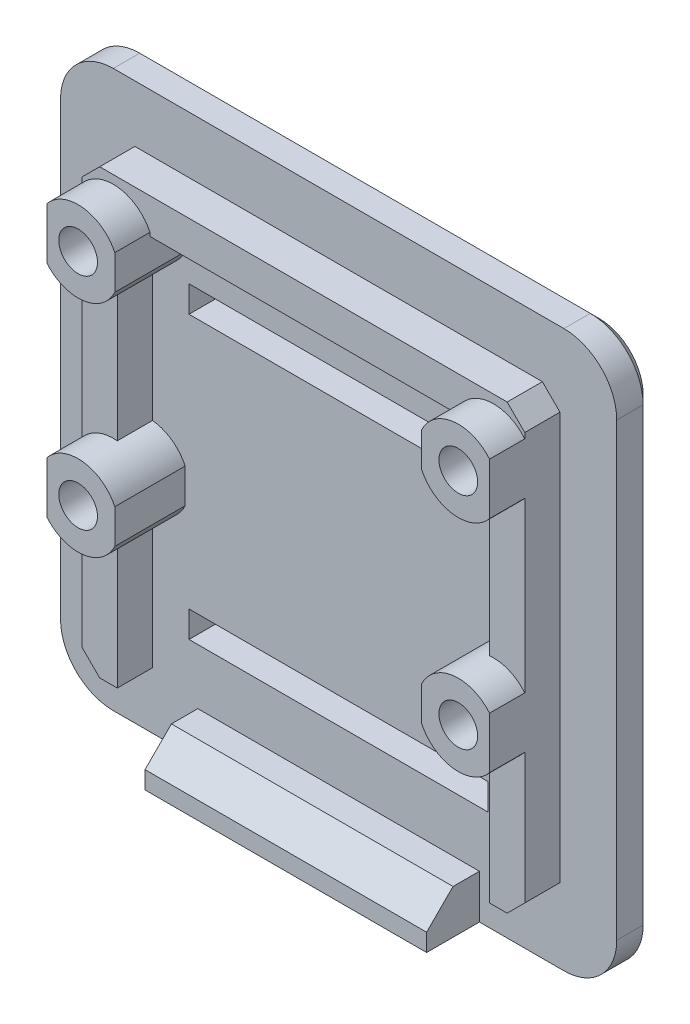
from build123d import *

# Parameters (mm, degrees)
SKETCH2_W           = 31.6
SKETCH2_H           = 31.6
BOSS_EXTRUDE1_DEPTH = 2
FILLET1_R           = 3
BOSS_EXTRUDE2_DEPTH = 2
CHAMFER1_SIZE       = 1
SKETCH6_W           = 16
SKETCH6_H           = 2.5
BOSS_EXTRUDE3_DEPTH = 3
BOSS_EXTRUDE4_DEPTH = 4
SKETCH8_R           = 1.1
CUT_EXTRUDE1_DEPTH  = 8
SKETCH9_R           = 2.25
CUT_EXTRUDE2_DEPTH  = 1
SKETCH10_W          = 17
SKETCH10_H          = 1.5
CUT_EXTRUDE3_DEPTH  = 5
CHAMFER2_SIZE       = 0.5
CHAMFER3_SIZE       = 1.5


with BuildPart() as part:
    # Sketch2 → Boss-Extrude1 (new body)
    with BuildSketch(Plane.XY):
        Rectangle(SKETCH2_W, SKETCH2_H)
    extrude(amount=BOSS_EXTRUDE1_DEPTH)

    # Fillet1
    fillet1_edges = [part.edges().sort_by_distance(p)[0] for p in [
        (-15.8, 15.8, 1),
        (15.8, 15.8, 1),
        (15.8, -15.8, 1),
        (-15.8, -15.8, 1),
    ]]
    fillet(fillet1_edges, radius=FILLET1_R)

    # Sketch5 → Boss-Extrude2 (add)
    with BuildSketch(Plane.XY.offset(2)):
        Polygon((-10.575, -12.575), (-10.575, 10.575), (10.575, 10.575), (10.575, -12.575), (12.575, -12.575), (12.575, 12.575), (-12.575, 12.575), (-12.575, -12.575), align=None)
    extrude(amount=BOSS_EXTRUDE2_DEPTH)

    # Chamfer1
    chamfer1_edges = [part.edges().sort_by_distance(p)[0] for p in [
        (-12.575, 12.575, 3),
        (-12.575, -12.575, 3),
        (12.575, -12.575, 3),
        (12.575, 12.575, 3),
    ]]
    chamfer(chamfer1_edges, length=CHAMFER1_SIZE)

    # Sketch6 → Boss-Extrude3 (add)
    with BuildSketch(Plane.XY.offset(2)):
        with Locations((0, -14.55)):
            Rectangle(SKETCH6_W, SKETCH6_H)
    extrude(amount=BOSS_EXTRUDE3_DEPTH)

    # Sketch7 → Boss-Extrude4 (add)
    with BuildSketch(Plane.XY.offset(2)):
        with BuildLine():
            Line((12.575, -4.162660527), (12.575, -1.237339569))
            ThreePointArc((12.575, -1.237339569), (10.512267156, -0.418068914), (8.717472576, -1.723742534))
            Line((8.717472576, -1.723742534), (8.717472576, -3.676257561))
            ThreePointArc((8.717472576, -3.676257561), (10.512267156, -4.981931182), (12.575, -4.162660527))
        make_face()
        with BuildLine():
            Line((-12.575, -1.237339569), (-12.575, -4.162660527))
            ThreePointArc((-12.575, -4.162660527), (-10.512267156, -4.981931182), (-8.717472576, -3.676257561))
            Line((-8.717472576, -3.676257561), (-8.717472576, -1.723742534))
            ThreePointArc((-8.717472576, -1.723742534), (-10.512267156, -0.418068914), (-12.575, -1.237339569))
        make_face()
        with BuildLine():
            Line((-12.575, 11.26266067), (-12.575, 8.337339712))
            ThreePointArc((-12.575, 8.337339712), (-10.512267156, 7.518069057), (-8.717472576, 8.823742677))
            Line((-8.717472576, 8.823742677), (-8.717472576, 10.776257704))
            ThreePointArc((-8.717472576, 10.776257704), (-10.512267156, 12.081931325), (-12.575, 11.26266067))
        make_face()
        with BuildLine():
            Line((12.575, 8.337339712), (12.575, 11.26266067))
            ThreePointArc((12.575, 11.26266067), (10.512267156, 12.081931325), (8.717472576, 10.776257704))
            Line((8.717472576, 10.776257704), (8.717472576, 8.823742677))
            ThreePointArc((8.717472576, 8.823742677), (10.512267156, 7.518069057), (12.575, 8.337339712))
        make_face()
    extrude(amount=BOSS_EXTRUDE4_DEPTH)

    # Sketch8 → Cut-Extrude1 (cut)
    with BuildSketch(Plane.XY.offset(6)):
        with Locations((10.800000191, -2.700000048)):
            Circle(SKETCH8_R)
        with Locations((-10.800000191, -2.700000048)):
            Circle(SKETCH8_R)
        with Locations((-10.800000191, 9.800000191)):
            Circle(SKETCH8_R)
        with Locations((10.800000191, 9.800000191)):
            Circle(SKETCH8_R)
    extrude(amount=-CUT_EXTRUDE1_DEPTH, mode=Mode.SUBTRACT)

    # Sketch9 → Cut-Extrude2 (cut)
    with BuildSketch(Plane(origin=(0, 0, 0), x_dir=(-1, 0, 0), z_dir=(0, 0, -1))):
        with Locations((10.800000191, -2.700000048)):
            Circle(SKETCH9_R)
        with Locations((-10.800000191, -2.700000048)):
            Circle(SKETCH9_R)
        with Locations((-10.800000191, 9.800000191)):
            Circle(SKETCH9_R)
        with Locations((10.800000191, 9.800000191)):
            Circle(SKETCH9_R)
    extrude(amount=-CUT_EXTRUDE2_DEPTH, mode=Mode.SUBTRACT)

    # Sketch10 → Cut-Extrude3 (cut)
    with BuildSketch(Plane.XY.offset(2)):
        with Locations((0, -9.395499737)):
            Rectangle(SKETCH10_W, SKETCH10_H)
        with Locations((0, 6.604500263)):
            Rectangle(SKETCH10_W, SKETCH10_H)
    extrude(amount=-CUT_EXTRUDE3_DEPTH, mode=Mode.SUBTRACT)

    # Chamfer2
    # the kernel refuses this chamfer: 0.5 mm, written as the material it takes off along each edge
    with BuildSketch(Plane(origin=(12.8, 15.8, 0), x_dir=(0, 0.02749587661058563, 0.9996219169112968), z_dir=(-1, 0, 0)), Plane(origin=(-15.8, 12.8, 0), x_dir=(-0.02749587661058563, 0, 0.9996219169112968), z_dir=(0, -1, 0)), Plane(origin=(15.8, -12.8, 0), x_dir=(0.02749587661058563, 0, 0.9996219169112968), z_dir=(0, 1, 0)), Plane(origin=(-12.8, -15.8, 0), x_dir=(0, -0.02749587661058563, 0.9996219169112968), z_dir=(1, 0, 0))) as chamfer2_piece_1:
        Polygon((CHAMFER2_SIZE * 0.999621916911, -CHAMFER2_SIZE * 0.0274958766106), (-CHAMFER2_SIZE * 0.0274958766106, -CHAMFER2_SIZE * 0.999621916911), (0, 0), align=None)
    extrude(amount=25.6, mode=Mode.SUBTRACT)
    with BuildSketch(Plane(origin=(-12.8, 12.8, 0), x_dir=(0, 1, 0), z_dir=(1, 0, 0))) as chamfer2_piece_2:
        Polygon((3, CHAMFER2_SIZE), (3 - CHAMFER2_SIZE, 0), (3, 0), align=None)
    revolve(axis=Axis((-12.8, 12.8, 0), (0, 0, 1)), revolution_arc=90, mode=Mode.SUBTRACT)
    with BuildSketch(Plane(origin=(-12.8, -12.8, 0), x_dir=(-1, 0, 0), z_dir=(0, 1, 0))) as chamfer2_piece_3:
        Polygon((3, CHAMFER2_SIZE), (3 - CHAMFER2_SIZE, 0), (3, 0), align=None)
    revolve(axis=Axis((-12.8, -12.8, 0), (0, 0, 1)), revolution_arc=90, mode=Mode.SUBTRACT)
    with BuildSketch(Plane(origin=(12.8, -12.8, 0), x_dir=(0, -1, 0), z_dir=(-1, 0, 0))) as chamfer2_piece_4:
        Polygon((3, CHAMFER2_SIZE), (3 - CHAMFER2_SIZE, 0), (3, 0), align=None)
    revolve(axis=Axis((12.8, -12.8, 0), (0, 0, 1)), revolution_arc=90, mode=Mode.SUBTRACT)
    with BuildSketch(Plane(origin=(12.8, 12.8, 0), x_dir=(0, 1, 0), z_dir=(-1, 0, 0))) as chamfer2_piece_5:
        Polygon((3, -CHAMFER2_SIZE), (3 - CHAMFER2_SIZE, 0), (3, 0), align=None)
    revolve(axis=Axis((12.8, 12.8, 0), (0, 0, -1)), revolution_arc=90, mode=Mode.SUBTRACT)
    with BuildSketch(Plane(origin=(-10.800000191, -2.700000048, 0), x_dir=(-1, 0, 0), z_dir=(0, -1, 0))) as chamfer2_piece_6:
        Polygon((2.25 + CHAMFER2_SIZE, 0), (2.25, -CHAMFER2_SIZE), (2.25, 0), align=None)
    revolve(axis=Axis((-10.800000191, -2.700000048, 0), (0, 0, -1)), mode=Mode.SUBTRACT)
    with BuildSketch(Plane(origin=(10.800000191, -2.700000048, 0), x_dir=(-1, 0, 0), z_dir=(0, -1, 0))) as chamfer2_piece_7:
        Polygon((2.25 + CHAMFER2_SIZE, 0), (2.25, -CHAMFER2_SIZE), (2.25, 0), align=None)
    revolve(axis=Axis((10.800000191, -2.700000048, 0), (0, 0, -1)), mode=Mode.SUBTRACT)
    with BuildSketch(Plane(origin=(10.800000191, 9.800000191, 0), x_dir=(-1, 0, 0), z_dir=(0, -1, 0))) as chamfer2_piece_8:
        Polygon((2.25 + CHAMFER2_SIZE, 0), (2.25, -CHAMFER2_SIZE), (2.25, 0), align=None)
    revolve(axis=Axis((10.800000191, 9.800000191, 0), (0, 0, -1)), mode=Mode.SUBTRACT)
    with BuildSketch(Plane(origin=(-10.800000191, 9.800000191, 0), x_dir=(-1, 0, 0), z_dir=(0, -1, 0))) as chamfer2_piece_9:
        Polygon((2.25 + CHAMFER2_SIZE, 0), (2.25, -CHAMFER2_SIZE), (2.25, 0), align=None)
    revolve(axis=Axis((-10.800000191, 9.800000191, 0), (0, 0, -1)), mode=Mode.SUBTRACT)
    with BuildSketch(Plane(origin=(-8.5, -10.145499737, 0), x_dir=(0, 0.02749587661058563, 0.9996219169112968), z_dir=(1, 0, 0)), Plane(origin=(8.5, -8.645499737, 0), x_dir=(0, -0.02749587661058563, 0.9996219169112968), z_dir=(-1, 0, 0)), Plane(origin=(-8.5, 5.854500263, 0), x_dir=(0, 0.027495876610583895, 0.9996219169112968), z_dir=(1, 0, 0)), Plane(origin=(8.5, 7.354500263, 0), x_dir=(0, -0.027495876610587354, 0.9996219169112968), z_dir=(-1, 0, 0))) as chamfer2_piece_10:
        Polygon((CHAMFER2_SIZE * 0.999621916911, CHAMFER2_SIZE * 0.0274958766106), (-CHAMFER2_SIZE * 0.0274958766106, CHAMFER2_SIZE * 0.999621916911), (0, 0), align=None)
    extrude(amount=17, mode=Mode.SUBTRACT)
    with BuildSketch(Plane(origin=(8.5, -10.145499737, 0), x_dir=(-0.02749587661058563, 0, 0.9996219169112968), z_dir=(0, 1, 0)), Plane(origin=(-8.5, -8.645499737, 0), x_dir=(0.02749587661058563, 0, 0.9996219169112968), z_dir=(0, -1, 0)), Plane(origin=(8.5, 5.854500263, 0), x_dir=(-0.02749587661058563, 0, 0.9996219169112968), z_dir=(0, 1, 0)), Plane(origin=(-8.5, 7.354500263, 0), x_dir=(0.02749587661058563, 0, 0.9996219169112968), z_dir=(0, -1, 0))) as chamfer2_piece_11:
        Polygon((CHAMFER2_SIZE * 0.999621916911, CHAMFER2_SIZE * 0.0274958766106), (-CHAMFER2_SIZE * 0.0274958766106, CHAMFER2_SIZE * 0.999621916911), (0, 0), align=None)
    extrude(amount=1.5, mode=Mode.SUBTRACT)
    with BuildSketch(Plane(origin=(-8.5, -8.645499737, 0), x_dir=(0.02749587661058563, 0, 0.9996219169112968), z_dir=(0, -1, 0))) as chamfer2_piece_12a_section:
        Polygon((CHAMFER2_SIZE * 0.999621916911, CHAMFER2_SIZE * 0.0274958766106), (-CHAMFER2_SIZE * 0.0274958766106, CHAMFER2_SIZE * 0.999621916911), (0, 0), align=None)
    chamfer2_piece_12a = extrude(amount=2.785841494, mode=Mode.PRIVATE)
    chamfer2_piece_12a = split(chamfer2_piece_12a, bisect_by=Plane(origin=(-8.664896813, -10.145499737, 0.164896813), z_dir=(0, -1, 0)), keep=Keep.TOP, mode=Mode.PRIVATE)
    with BuildSketch(Plane(origin=(-9.785841494, -10.145499737, 0), x_dir=(0, 0.02749587661058563, 0.9996219169112968), z_dir=(1, 0, 0))) as chamfer2_piece_12b_section:
        Polygon((CHAMFER2_SIZE * 0.999621916911, CHAMFER2_SIZE * 0.0274958766106), (-CHAMFER2_SIZE * 0.0274958766106, CHAMFER2_SIZE * 0.999621916911), (0, 0), align=None)
    chamfer2_piece_12b = extrude(amount=18.285841494, mode=Mode.PRIVATE)
    chamfer2_piece_12b = split(chamfer2_piece_12b, bisect_by=Plane(origin=(-8.5, -10.310396551, 0.164896813), z_dir=(-1, 0, 0)), keep=Keep.TOP, mode=Mode.PRIVATE)
    chamfer2_piece_12 = chamfer2_piece_12a & chamfer2_piece_12b
    add(chamfer2_piece_12, mode=Mode.SUBTRACT)
    with BuildSketch(Plane(origin=(-8.5, -10.145499737, 0), x_dir=(0, 0.02749587661058563, 0.9996219169112968), z_dir=(1, 0, 0))) as chamfer2_piece_13a_section:
        Polygon((CHAMFER2_SIZE * 0.999621916911, CHAMFER2_SIZE * 0.0274958766106), (-CHAMFER2_SIZE * 0.0274958766106, CHAMFER2_SIZE * 0.999621916911), (0, 0), align=None)
    chamfer2_piece_13a = extrude(amount=18.285841494, mode=Mode.PRIVATE)
    chamfer2_piece_13a = split(chamfer2_piece_13a, bisect_by=Plane(origin=(8.5, -10.310396551, 0.164896813), z_dir=(1, 0, 0)), keep=Keep.TOP, mode=Mode.PRIVATE)
    with BuildSketch(Plane(origin=(8.5, -11.431341231, 0), x_dir=(-0.02749587661058563, 0, 0.9996219169112968), z_dir=(0, 1, 0))) as chamfer2_piece_13b_section:
        Polygon((CHAMFER2_SIZE * 0.999621916911, CHAMFER2_SIZE * 0.0274958766106), (-CHAMFER2_SIZE * 0.0274958766106, CHAMFER2_SIZE * 0.999621916911), (0, 0), align=None)
    chamfer2_piece_13b = extrude(amount=2.785841494, mode=Mode.PRIVATE)
    chamfer2_piece_13b = split(chamfer2_piece_13b, bisect_by=Plane(origin=(8.664896813, -10.145499737, 0.164896813), z_dir=(0, -1, 0)), keep=Keep.TOP, mode=Mode.PRIVATE)
    chamfer2_piece_13 = chamfer2_piece_13a & chamfer2_piece_13b
    add(chamfer2_piece_13, mode=Mode.SUBTRACT)
    with BuildSketch(Plane(origin=(9.785841494, -8.645499737, 0), x_dir=(0, -0.02749587661058563, 0.9996219169112968), z_dir=(-1, 0, 0))) as chamfer2_piece_14a_section:
        Polygon((CHAMFER2_SIZE * 0.999621916911, CHAMFER2_SIZE * 0.0274958766106), (-CHAMFER2_SIZE * 0.0274958766106, CHAMFER2_SIZE * 0.999621916911), (0, 0), align=None)
    chamfer2_piece_14a = extrude(amount=18.285841494, mode=Mode.PRIVATE)
    chamfer2_piece_14a = split(chamfer2_piece_14a, bisect_by=Plane(origin=(8.5, -8.480602924, 0.164896813), z_dir=(1, 0, 0)), keep=Keep.TOP, mode=Mode.PRIVATE)
    with BuildSketch(Plane(origin=(8.5, -10.145499737, 0), x_dir=(-0.02749587661058563, 0, 0.9996219169112968), z_dir=(0, 1, 0))) as chamfer2_piece_14b_section:
        Polygon((CHAMFER2_SIZE * 0.999621916911, CHAMFER2_SIZE * 0.0274958766106), (-CHAMFER2_SIZE * 0.0274958766106, CHAMFER2_SIZE * 0.999621916911), (0, 0), align=None)
    chamfer2_piece_14b = extrude(amount=2.785841494, mode=Mode.PRIVATE)
    chamfer2_piece_14b = split(chamfer2_piece_14b, bisect_by=Plane(origin=(8.664896813, -8.645499737, 0.164896813), z_dir=(0, 1, 0)), keep=Keep.TOP, mode=Mode.PRIVATE)
    chamfer2_piece_14 = chamfer2_piece_14a & chamfer2_piece_14b
    add(chamfer2_piece_14, mode=Mode.SUBTRACT)
    with BuildSketch(Plane(origin=(8.5, -8.645499737, 0), x_dir=(0, -0.02749587661058563, 0.9996219169112968), z_dir=(-1, 0, 0))) as chamfer2_piece_15a_section:
        Polygon((CHAMFER2_SIZE * 0.999621916911, CHAMFER2_SIZE * 0.0274958766106), (-CHAMFER2_SIZE * 0.0274958766106, CHAMFER2_SIZE * 0.999621916911), (0, 0), align=None)
    chamfer2_piece_15a = extrude(amount=18.285841494, mode=Mode.PRIVATE)
    chamfer2_piece_15a = split(chamfer2_piece_15a, bisect_by=Plane(origin=(-8.5, -8.480602924, 0.164896813), z_dir=(-1, 0, 0)), keep=Keep.TOP, mode=Mode.PRIVATE)
    with BuildSketch(Plane(origin=(-8.5, -7.359658243, 0), x_dir=(0.02749587661058563, 0, 0.9996219169112968), z_dir=(0, -1, 0))) as chamfer2_piece_15b_section:
        Polygon((CHAMFER2_SIZE * 0.999621916911, CHAMFER2_SIZE * 0.0274958766106), (-CHAMFER2_SIZE * 0.0274958766106, CHAMFER2_SIZE * 0.999621916911), (0, 0), align=None)
    chamfer2_piece_15b = extrude(amount=2.785841494, mode=Mode.PRIVATE)
    chamfer2_piece_15b = split(chamfer2_piece_15b, bisect_by=Plane(origin=(-8.664896813, -8.645499737, 0.164896813), z_dir=(0, 1, 0)), keep=Keep.TOP, mode=Mode.PRIVATE)
    chamfer2_piece_15 = chamfer2_piece_15a & chamfer2_piece_15b
    add(chamfer2_piece_15, mode=Mode.SUBTRACT)
    with BuildSketch(Plane(origin=(-8.5, 7.354500263, 0), x_dir=(0.02749587661058563, 0, 0.9996219169112968), z_dir=(0, -1, 0))) as chamfer2_piece_16a_section:
        Polygon((CHAMFER2_SIZE * 0.999621916911, CHAMFER2_SIZE * 0.0274958766106), (-CHAMFER2_SIZE * 0.0274958766106, CHAMFER2_SIZE * 0.999621916911), (0, 0), align=None)
    chamfer2_piece_16a = extrude(amount=2.785841494, mode=Mode.PRIVATE)
    chamfer2_piece_16a = split(chamfer2_piece_16a, bisect_by=Plane(origin=(-8.664896813, 5.854500263, 0.164896813), z_dir=(0, -1, 0)), keep=Keep.TOP, mode=Mode.PRIVATE)
    with BuildSketch(Plane(origin=(-9.785841494, 5.854500263, 0), x_dir=(0, 0.02749587661058563, 0.9996219169112968), z_dir=(1, 0, 0))) as chamfer2_piece_16b_section:
        Polygon((CHAMFER2_SIZE * 0.999621916911, CHAMFER2_SIZE * 0.0274958766106), (-CHAMFER2_SIZE * 0.0274958766106, CHAMFER2_SIZE * 0.999621916911), (0, 0), align=None)
    chamfer2_piece_16b = extrude(amount=18.285841494, mode=Mode.PRIVATE)
    chamfer2_piece_16b = split(chamfer2_piece_16b, bisect_by=Plane(origin=(-8.5, 5.689603449, 0.164896813), z_dir=(-1, 0, 0)), keep=Keep.TOP, mode=Mode.PRIVATE)
    chamfer2_piece_16 = chamfer2_piece_16a & chamfer2_piece_16b
    add(chamfer2_piece_16, mode=Mode.SUBTRACT)
    with BuildSketch(Plane(origin=(-8.5, 5.854500263, 0), x_dir=(0, 0.027495876610583895, 0.9996219169112968), z_dir=(1, 0, 0))) as chamfer2_piece_17a_section:
        Polygon((CHAMFER2_SIZE * 0.999621916911, CHAMFER2_SIZE * 0.0274958766106), (-CHAMFER2_SIZE * 0.0274958766106, CHAMFER2_SIZE * 0.999621916911), (0, 0), align=None)
    chamfer2_piece_17a = extrude(amount=18.285841494, mode=Mode.PRIVATE)
    chamfer2_piece_17a = split(chamfer2_piece_17a, bisect_by=Plane(origin=(8.5, 5.689603449, 0.164896813), z_dir=(1, 0, 0)), keep=Keep.TOP, mode=Mode.PRIVATE)
    with BuildSketch(Plane(origin=(8.5, 4.568658769, 0), x_dir=(-0.02749587661058563, 0, 0.9996219169112968), z_dir=(0, 1, 0))) as chamfer2_piece_17b_section:
        Polygon((CHAMFER2_SIZE * 0.999621916911, CHAMFER2_SIZE * 0.0274958766106), (-CHAMFER2_SIZE * 0.0274958766106, CHAMFER2_SIZE * 0.999621916911), (0, 0), align=None)
    chamfer2_piece_17b = extrude(amount=2.785841494, mode=Mode.PRIVATE)
    chamfer2_piece_17b = split(chamfer2_piece_17b, bisect_by=Plane(origin=(8.664896813, 5.854500263, 0.164896813), z_dir=(0, -1, 0)), keep=Keep.TOP, mode=Mode.PRIVATE)
    chamfer2_piece_17 = chamfer2_piece_17a & chamfer2_piece_17b
    add(chamfer2_piece_17, mode=Mode.SUBTRACT)
    with BuildSketch(Plane(origin=(9.785841494, 7.354500263, 0), x_dir=(0, -0.02749587661058563, 0.9996219169112968), z_dir=(-1, 0, 0))) as chamfer2_piece_18a_section:
        Polygon((CHAMFER2_SIZE * 0.999621916911, CHAMFER2_SIZE * 0.0274958766106), (-CHAMFER2_SIZE * 0.0274958766106, CHAMFER2_SIZE * 0.999621916911), (0, 0), align=None)
    chamfer2_piece_18a = extrude(amount=18.285841494, mode=Mode.PRIVATE)
    chamfer2_piece_18a = split(chamfer2_piece_18a, bisect_by=Plane(origin=(8.5, 7.519397076, 0.164896813), z_dir=(1, 0, 0)), keep=Keep.TOP, mode=Mode.PRIVATE)
    with BuildSketch(Plane(origin=(8.5, 5.854500263, 0), x_dir=(-0.02749587661058563, 0, 0.9996219169112968), z_dir=(0, 1, 0))) as chamfer2_piece_18b_section:
        Polygon((CHAMFER2_SIZE * 0.999621916911, CHAMFER2_SIZE * 0.0274958766106), (-CHAMFER2_SIZE * 0.0274958766106, CHAMFER2_SIZE * 0.999621916911), (0, 0), align=None)
    chamfer2_piece_18b = extrude(amount=2.785841494, mode=Mode.PRIVATE)
    chamfer2_piece_18b = split(chamfer2_piece_18b, bisect_by=Plane(origin=(8.664896813, 7.354500263, 0.164896813), z_dir=(0, 1, 0)), keep=Keep.TOP, mode=Mode.PRIVATE)
    chamfer2_piece_18 = chamfer2_piece_18a & chamfer2_piece_18b
    add(chamfer2_piece_18, mode=Mode.SUBTRACT)
    with BuildSketch(Plane(origin=(8.5, 7.354500263, 0), x_dir=(0, -0.027495876610587354, 0.9996219169112968), z_dir=(-1, 0, 0))) as chamfer2_piece_19a_section:
        Polygon((CHAMFER2_SIZE * 0.999621916911, CHAMFER2_SIZE * 0.0274958766106), (-CHAMFER2_SIZE * 0.0274958766106, CHAMFER2_SIZE * 0.999621916911), (0, 0), align=None)
    chamfer2_piece_19a = extrude(amount=18.285841494, mode=Mode.PRIVATE)
    chamfer2_piece_19a = split(chamfer2_piece_19a, bisect_by=Plane(origin=(-8.5, 7.519397076, 0.164896813), z_dir=(-1, 0, 0)), keep=Keep.TOP, mode=Mode.PRIVATE)
    with BuildSketch(Plane(origin=(-8.5, 8.640341757, 0), x_dir=(0.02749587661058563, 0, 0.9996219169112968), z_dir=(0, -1, 0))) as chamfer2_piece_19b_section:
        Polygon((CHAMFER2_SIZE * 0.999621916911, CHAMFER2_SIZE * 0.0274958766106), (-CHAMFER2_SIZE * 0.0274958766106, CHAMFER2_SIZE * 0.999621916911), (0, 0), align=None)
    chamfer2_piece_19b = extrude(amount=2.785841494, mode=Mode.PRIVATE)
    chamfer2_piece_19b = split(chamfer2_piece_19b, bisect_by=Plane(origin=(-8.664896813, 7.354500263, 0.164896813), z_dir=(0, 1, 0)), keep=Keep.TOP, mode=Mode.PRIVATE)
    chamfer2_piece_19 = chamfer2_piece_19a & chamfer2_piece_19b
    add(chamfer2_piece_19, mode=Mode.SUBTRACT)

    # Chamfer3
    chamfer3_edges = [part.edges().sort_by_distance(p)[0] for p in [
        (0, -13.3, 5),
    ]]
    chamfer(chamfer3_edges, length=CHAMFER3_SIZE)


solid = part.part
